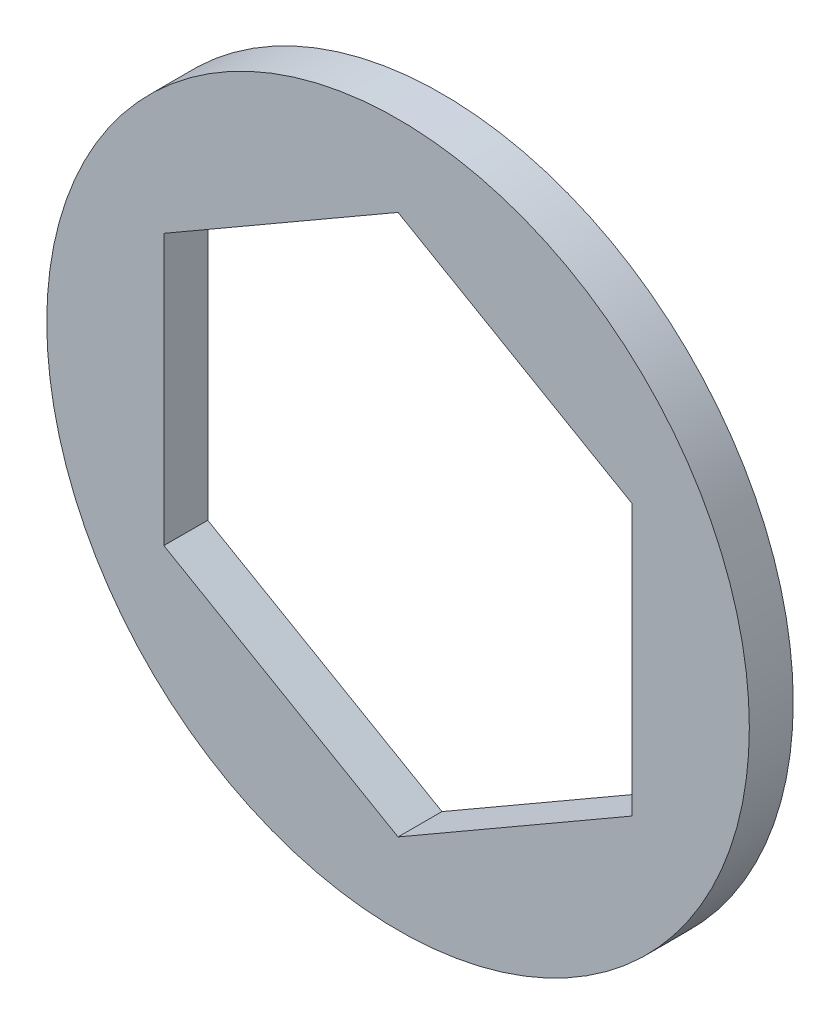
from build123d import *

# Parameters (mm, degrees)
SKETCH1_R           = 9.525
BOSS_EXTRUDE1_DEPTH = 1.190625


with BuildPart() as part:
    # Sketch1 → Boss-Extrude1 (new body)
    with BuildSketch(Plane.XY):
        Circle(SKETCH1_R)
        Polygon((0, 7.332348419), (-6.35, 3.666174209), (-6.35, -3.666174209), (0, -7.332348419), (6.35, -3.666174209), (6.35, 3.666174209), align=None, mode=Mode.SUBTRACT)
    extrude(amount=BOSS_EXTRUDE1_DEPTH)


solid = part.part
